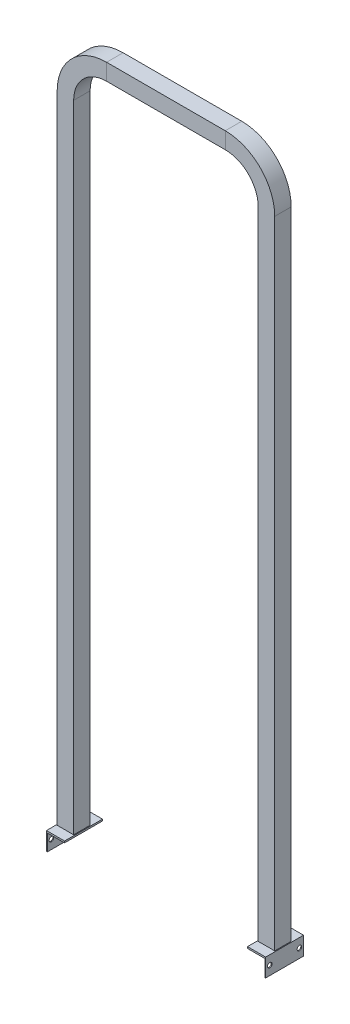
from build123d import *

# Parameters (mm, degrees)
SKETCH2_W           = 55
SKETCH2_H           = 115
BOSS_EXTRUDE1_DEPTH = 5
SKETCH5_W           = 50
SKETCH5_H           = 50
SKETCH5_W_2         = 40
SKETCH5_H_2         = 40
SWEEP2_START        = -22.5
SWEEP2_DEPTH        = 50
SWEEP2_2_DEPTH      = 5
SWEEP2_START_2      = 22.5
SWEEP2_3_DEPTH      = 5
SKETCH11_R          = 12.5
CUT_EXTRUDE2_DEPTH  = 25
SKETCH12_R          = 12.5
CUT_EXTRUDE3_DEPTH  = 25
SKETCH13_W          = 2.5
SKETCH13_H          = 115
BOSS_EXTRUDE2_DEPTH = 50
SKETCH15_W          = 2.5
SKETCH15_H          = 115
BOSS_EXTRUDE3_DEPTH = 50
SKETCH14_R          = 7
CUT_EXTRUDE4_DEPTH  = 2185.475051357


# Read off the part's stored shape, not the designer's step: Sweep2
with BuildPart() as part:
    # Sketch2 → Boss-Extrude1 (new body)
    with BuildSketch(Plane(origin=(0, 0, 0), x_dir=(1, 0, 0), z_dir=(0, 1, 0))):
        Rectangle(SKETCH2_W, SKETCH2_H)
    extrude(amount=-BOSS_EXTRUDE1_DEPTH)

    # Sweep1: sweep along a path in Sketch7
    with BuildLine(Plane(origin=(0, 0, 0), x_dir=(0, 0, -1), z_dir=(1, 0, 0))) as sweep1_path:
        Line((-2.5, 0), (-2.5, 1930))
    # Sketch5 → Sweep1 (sweep)
    with BuildSketch(Plane(origin=(0, 0, 0), x_dir=(1, 0, 0), z_dir=(0, 1, 0))):
        with Locations((0, -2.5)):
            Rectangle(SKETCH5_W, SKETCH5_H)
        with Locations((0, -2.5)):
            Rectangle(SKETCH5_W_2, SKETCH5_H_2, mode=Mode.SUBTRACT)
    sweep(path=sweep1_path.line)

    # Sweep2 outline → Sweep2 (add)
    with BuildSketch(Plane.XY.offset(SWEEP2_START)):
        with BuildLine():
            ThreePointArc((125, 2080), (18.933982822, 2036.066017178), (-25, 1930))
            Line((-25, 1930), (-20, 1930))
            ThreePointArc((-20, 1930), (22.469516728, 2032.530483272), (125, 2075))
            Line((125, 2075), (305, 2075))
            Line((305, 2075), (305, 2080))
            Line((305, 2080), (125, 2080))
        make_face()
        with BuildLine():
            ThreePointArc((125, 2035), (50.753787975, 2004.246212025), (20, 1930))
            Line((20, 1930), (25, 1930))
            ThreePointArc((25, 1930), (54.289321881, 2000.710678119), (125, 2030))
            Line((125, 2030), (305, 2030))
            Line((305, 2030), (305, 2035))
            Line((305, 2035), (125, 2035))
        make_face()
    extrude(amount=SWEEP2_DEPTH)

    # Sweep2 2 outline → Sweep2 2 (add)
    with BuildSketch(Plane.XY.offset(SWEEP2_START)):
        with BuildLine():
            ThreePointArc((125, 2075), (22.469516728, 2032.530483272), (-20, 1930))
            Line((-20, 1930), (20, 1930))
            ThreePointArc((20, 1930), (50.753787975, 2004.246212025), (125, 2035))
            Line((125, 2035), (305, 2035))
            Line((305, 2035), (305, 2075))
            Line((305, 2075), (125, 2075))
        make_face()
    extrude(amount=SWEEP2_2_DEPTH)

    # Sweep2 3 outline → Sweep2 3 (add)
    with BuildSketch(Plane.XY.offset(SWEEP2_START_2)):
        with BuildLine():
            ThreePointArc((125, 2075), (22.469516728, 2032.530483272), (-20, 1930))
            Line((-20, 1930), (20, 1930))
            ThreePointArc((20, 1930), (50.753787975, 2004.246212025), (125, 2035))
            Line((125, 2035), (305, 2035))
            Line((305, 2035), (305, 2075))
            Line((305, 2075), (125, 2075))
        make_face()
    extrude(amount=SWEEP2_3_DEPTH)

    # Mirror1: part across plane


with BuildPart() as part_1:
    add(part.part)
    add(part.part.mirror(Plane(origin=(305, 2055, 0), x_dir=(0, 0, 1), z_dir=(1, 0, 0))))

    # Sketch11 → Cut-Extrude2 (cut)
    with BuildSketch(Plane.XZ.offset(-2030)):
        with Locations((395, 2.5)):
            Circle(SKETCH11_R)
    extrude(amount=-CUT_EXTRUDE2_DEPTH, mode=Mode.SUBTRACT)

    # Sketch12 → Cut-Extrude3 (cut)
    with BuildSketch(Plane.XZ.offset(-2030)):
        with Locations((395, 2.5)):
            Circle(SKETCH12_R)
        with Locations(Location((215, 2.5, 0), (0, 0, 180))):
            Circle(SKETCH12_R)
    extrude(amount=-CUT_EXTRUDE3_DEPTH, mode=Mode.SUBTRACT)

    # Sketch13 → Boss-Extrude2 (add)
    with BuildSketch(Plane.XZ.offset(5)):
        with Locations((-26.25, 0)):
            Rectangle(SKETCH13_W, SKETCH13_H)
    extrude(amount=BOSS_EXTRUDE2_DEPTH)

    # Sketch15 → Boss-Extrude3 (add)
    with BuildSketch(Plane.XZ.offset(5)):
        with Locations((636.25, 0)):
            Rectangle(SKETCH15_W, SKETCH15_H)
    extrude(amount=BOSS_EXTRUDE3_DEPTH)

    # Sketch14 → Cut-Extrude4 (cut, through all)
    with BuildSketch(Plane.ZY.offset(27.5)):
        with Locations((-45, -27.5)):
            Circle(SKETCH14_R)
        with Locations((45, -27.5)):
            Circle(SKETCH14_R)
    extrude(amount=-CUT_EXTRUDE4_DEPTH, mode=Mode.SUBTRACT)


solid = part_1.part
